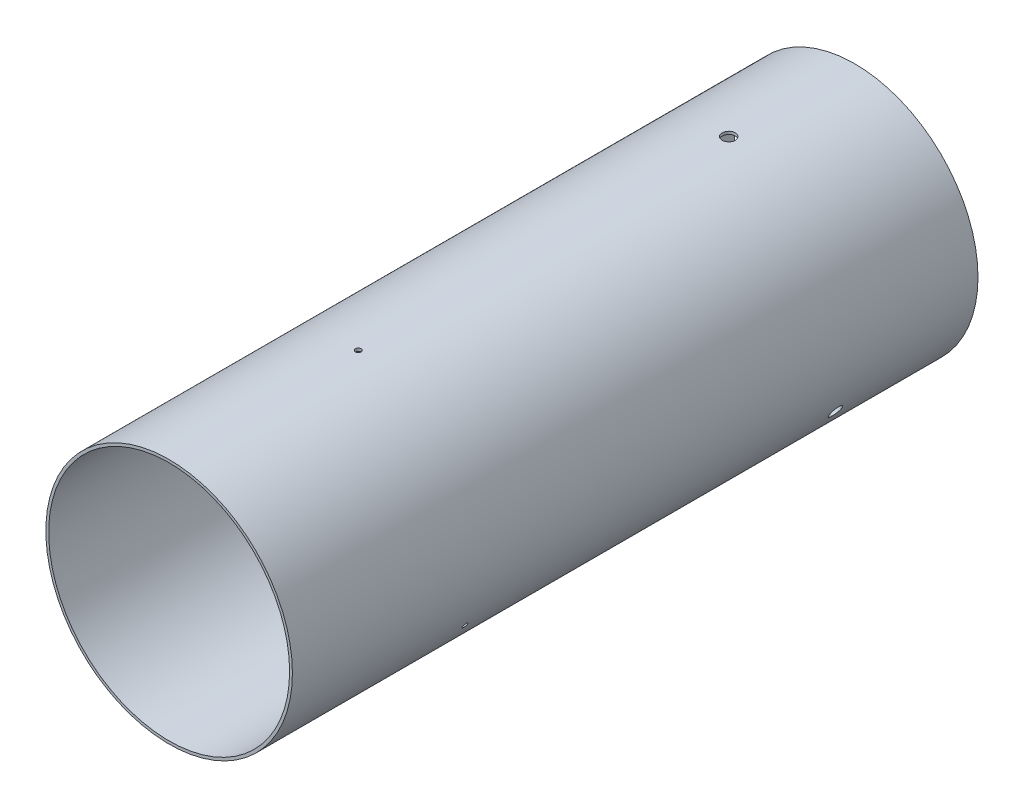
from build123d import *

# Parameters (mm, degrees)
SKETCH1_R                = 49.6697
SKETCH1_R_2              = 48.5394
BOSS_EXTRUDE1_DEPTH      = 276.225
SKETCH2_R                = 2.6289
SKETCH2_R_2              = 1.143
F_8_32_T_NUT_HOLES_DEPTH = 5.08
CIRPATTERN1_COUNT        = 3


with BuildPart() as part:
    # Sketch1 → Boss-Extrude1 (new body)
    with BuildSketch(Plane.XY):
        Circle(SKETCH1_R)
        Circle(SKETCH1_R_2, mode=Mode.SUBTRACT)
    extrude(amount=BOSS_EXTRUDE1_DEPTH)

    # Sketch2 → 8-32 T-Nut Holes (cut)
    with BuildSketch(Plane(origin=(0, 49.6697, 0), x_dir=(1, 0, 0), z_dir=(0, 1, 0))):
        with Locations((0, -50.8)):
            Circle(SKETCH2_R)
        with Locations((0, -200.025)):
            Circle(SKETCH2_R_2)
    f_8_32_t_nut_holes = extrude(amount=-F_8_32_T_NUT_HOLES_DEPTH, mode=Mode.SUBTRACT)

    # CirPattern1: 8-32 T-Nut Holes ×3 about axis
    cirpattern1_axis = Axis((0, 0, 276.225), (0, 0, -1))
    for i in range(1, CIRPATTERN1_COUNT):
        add(f_8_32_t_nut_holes.rotate(cirpattern1_axis, i * 360 / CIRPATTERN1_COUNT), mode=Mode.SUBTRACT)


solid = part.part
